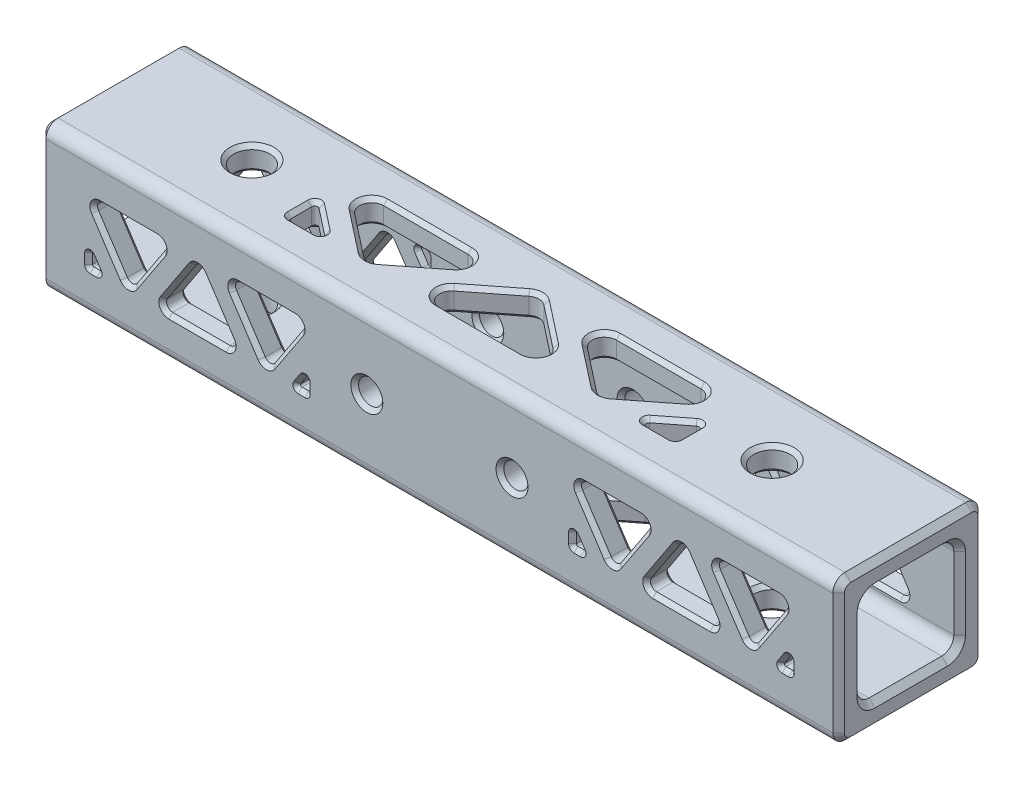
from build123d import *

# Parameters (mm, degrees)
SKETCH1_W                      = 19.05
SKETCH1_H                      = 19.05
SKETCH1_W_2                    = 12.7
SKETCH1_H_2                    = 12.7
BOSS_EXTRUDE1_DEPTH            = 52.3875
F_3_16_0_1875_DIAMETER_HOLE1_D = 4.7625
F_1_8_0_125_DIAMETER_HOLE1_D   = 3.175
CUT_EXTRUDE1_REACH             = 58.552
CUT_EXTRUDE2_REACH             = 58.552
CIRPATTERN1_COUNT              = 2
CIRPATTERN2_COUNT              = 2
FILLET1_R                      = 1.5875
FILLET4_R                      = 0.79375
FILLET2_R                      = 0.396875
FILLET3_R                      = 0.1984375
CHAMFER1_SIZE                  = 0.762
CHAMFER2_SIZE                  = 0.508


with BuildPart() as part:
    # Sketch1 → Boss-Extrude1 (new, symmetric)
    with BuildSketch(Plane(origin=(0, 0, 0), x_dir=(0, 0, -1), z_dir=(1, 0, 0))):
        Rectangle(SKETCH1_W, SKETCH1_H)
        Rectangle(SKETCH1_W_2, SKETCH1_H_2, mode=Mode.SUBTRACT)
    extrude(amount=BOSS_EXTRUDE1_DEPTH, both=True)

    # 3/16 (0.1875) Diameter Hole1 (through all)
    with Locations(Plane(origin=(0, 9.525, 0), x_dir=(1, 0, 0), z_dir=(0, 1, 0))):
        with Locations((-34.13125, 0), (34.13125, 0)):
            Hole(F_3_16_0_1875_DIAMETER_HOLE1_D / 2)

    # 1/8 (0.125) Diameter Hole1 (through all)
    with Locations(Plane(origin=(0, 0, -9.525), x_dir=(-1, 0, 0), z_dir=(0, 0, -1))):
        with Locations((-9.525, 0), (9.525, 0)):
            Hole(F_1_8_0_125_DIAMETER_HOLE1_D / 2)

    # Sketch8 → Cut-Extrude1 (cut, up to next)
    with BuildSketch(Plane(origin=(0, 9.525, 0), x_dir=(1, 0, 0), z_dir=(0, 1, 0)), mode=Mode.PRIVATE) as cut_extrude1_sk1:
        Polygon((-25.4, -0.065347152), (-25.4, -3.96875), (-20.420043773, -3.96875), align=None)
    cut_extrude1_tool1 = extrude(cut_extrude1_sk1.sketch, amount=-CUT_EXTRUDE1_REACH, mode=Mode.PRIVATE) & part.part
    # Sketch8 → Cut-Extrude1 (cut, up to next)
    with BuildSketch(Plane(origin=(0, 9.525, 0), x_dir=(1, 0, 0), z_dir=(0, 1, 0)), mode=Mode.PRIVATE) as cut_extrude1_sk2:
        Polygon((-25.4, 3.96875), (-15.273347924, -3.96875), (-5.146695849, 3.96875), align=None)
    cut_extrude1_tool2 = extrude(cut_extrude1_sk2.sketch, amount=-CUT_EXTRUDE1_REACH, mode=Mode.PRIVATE) & part.part
    # Sketch8 → Cut-Extrude1 (cut, up to next)
    with BuildSketch(Plane(origin=(0, 9.525, 0), x_dir=(1, 0, 0), z_dir=(0, 1, 0)), mode=Mode.PRIVATE) as cut_extrude1_sk3:
        Polygon((-10.126652076, -3.96875), (0, 3.96875), (10.126652076, -3.96875), align=None)
    cut_extrude1_tool3 = extrude(cut_extrude1_sk3.sketch, amount=-CUT_EXTRUDE1_REACH, mode=Mode.PRIVATE) & part.part
    # Sketch8 → Cut-Extrude1 (cut, up to next)
    with BuildSketch(Plane(origin=(0, 9.525, 0), x_dir=(1, 0, 0), z_dir=(0, 1, 0)), mode=Mode.PRIVATE) as cut_extrude1_sk4:
        Polygon((25.4, 3.96875), (15.273347924, -3.96875), (5.146695849, 3.96875), align=None)
    cut_extrude1_tool4 = extrude(cut_extrude1_sk4.sketch, amount=-CUT_EXTRUDE1_REACH, mode=Mode.PRIVATE) & part.part
    # Sketch8 → Cut-Extrude1 (cut, up to next)
    with BuildSketch(Plane(origin=(0, 9.525, 0), x_dir=(1, 0, 0), z_dir=(0, 1, 0)), mode=Mode.PRIVATE) as cut_extrude1_sk5:
        Polygon((25.4, -3.96875), (25.4, -0.065347152), (20.420043773, -3.96875), align=None)
    cut_extrude1_tool5 = extrude(cut_extrude1_sk5.sketch, amount=-CUT_EXTRUDE1_REACH, mode=Mode.PRIVATE) & part.part
    cut_extrude1_1 = cut_extrude1_tool1.solids().sort_by_distance((-23.740015, 9.525, 2.667616))[0]
    add(cut_extrude1_1, mode=Mode.SUBTRACT)
    cut_extrude1_2 = cut_extrude1_tool2.solids().sort_by_distance((-15.273348, 9.525, -1.322917))[0]
    add(cut_extrude1_2, mode=Mode.SUBTRACT)
    cut_extrude1_3 = cut_extrude1_tool3.solids().sort_by_distance((0, 9.525, 1.322917))[0]
    add(cut_extrude1_3, mode=Mode.SUBTRACT)
    cut_extrude1_4 = cut_extrude1_tool4.solids().sort_by_distance((15.273348, 9.525, -1.322917))[0]
    add(cut_extrude1_4, mode=Mode.SUBTRACT)
    cut_extrude1_5 = cut_extrude1_tool5.solids().sort_by_distance((23.740015, 9.525, 2.667616))[0]
    add(cut_extrude1_5, mode=Mode.SUBTRACT)
    cut_extrude1 = cut_extrude1_1 + cut_extrude1_2 + cut_extrude1_3 + cut_extrude1_4 + cut_extrude1_5  # Cut-Extrude1 as one shape, for the pattern or mirror that repeats it

    # Sketch9 → Cut-Extrude2 (cut, up to next)
    with BuildSketch(Plane.XY.offset(9.525), mode=Mode.PRIVATE) as cut_extrude2_sk1:
        Polygon((-46.0375, 3.96875), (-40.796126441, -3.96875), (-35.554752881, 3.96875), align=None)
    cut_extrude2_tool1 = extrude(cut_extrude2_sk1.sketch, amount=-CUT_EXTRUDE2_REACH, mode=Mode.PRIVATE) & part.part
    # Sketch9 → Cut-Extrude2 (cut, up to next)
    with BuildSketch(Plane.XY.offset(9.525), mode=Mode.PRIVATE) as cut_extrude2_sk2:
        Polygon((-36.991373559, -3.96875), (-31.75, 3.96875), (-26.508626441, -3.96875), align=None)
    cut_extrude2_tool2 = extrude(cut_extrude2_sk2.sketch, amount=-CUT_EXTRUDE2_REACH, mode=Mode.PRIVATE) & part.part
    # Sketch9 → Cut-Extrude2 (cut, up to next)
    with BuildSketch(Plane.XY.offset(9.525), mode=Mode.PRIVATE) as cut_extrude2_sk3:
        Polygon((-17.4625, 3.96875), (-22.703873559, -3.96875), (-27.945247119, 3.96875), align=None)
    cut_extrude2_tool3 = extrude(cut_extrude2_sk3.sketch, amount=-CUT_EXTRUDE2_REACH, mode=Mode.PRIVATE) & part.part
    # Sketch9 → Cut-Extrude2 (cut, up to next)
    with BuildSketch(Plane.XY.offset(9.525), mode=Mode.PRIVATE) as cut_extrude2_sk4:
        Polygon((-46.0375, -1.793141545), (-46.0375, -3.96875), (-44.600879322, -3.96875), align=None)
    cut_extrude2_tool4 = extrude(cut_extrude2_sk4.sketch, amount=-CUT_EXTRUDE2_REACH, mode=Mode.PRIVATE) & part.part
    # Sketch9 → Cut-Extrude2 (cut, up to next)
    with BuildSketch(Plane.XY.offset(9.525), mode=Mode.PRIVATE) as cut_extrude2_sk5:
        Polygon((-17.4625, -3.96875), (-17.4625, -1.793141545), (-18.899120678, -3.96875), align=None)
    cut_extrude2_tool5 = extrude(cut_extrude2_sk5.sketch, amount=-CUT_EXTRUDE2_REACH, mode=Mode.PRIVATE) & part.part
    # Sketch9 → Cut-Extrude2 (cut, up to next)
    with BuildSketch(Plane.XY.offset(9.525), mode=Mode.PRIVATE) as cut_extrude2_sk6:
        Polygon((17.4625, 3.96875), (22.703873559, -3.96875), (27.945247119, 3.96875), align=None)
    cut_extrude2_tool6 = extrude(cut_extrude2_sk6.sketch, amount=-CUT_EXTRUDE2_REACH, mode=Mode.PRIVATE) & part.part
    # Sketch9 → Cut-Extrude2 (cut, up to next)
    with BuildSketch(Plane.XY.offset(9.525), mode=Mode.PRIVATE) as cut_extrude2_sk7:
        Polygon((26.508626441, -3.96875), (31.75, 3.96875), (36.991373559, -3.96875), align=None)
    cut_extrude2_tool7 = extrude(cut_extrude2_sk7.sketch, amount=-CUT_EXTRUDE2_REACH, mode=Mode.PRIVATE) & part.part
    # Sketch9 → Cut-Extrude2 (cut, up to next)
    with BuildSketch(Plane.XY.offset(9.525), mode=Mode.PRIVATE) as cut_extrude2_sk8:
        Polygon((46.0375, 3.96875), (40.796126441, -3.96875), (35.554752881, 3.96875), align=None)
    cut_extrude2_tool8 = extrude(cut_extrude2_sk8.sketch, amount=-CUT_EXTRUDE2_REACH, mode=Mode.PRIVATE) & part.part
    # Sketch9 → Cut-Extrude2 (cut, up to next)
    with BuildSketch(Plane.XY.offset(9.525), mode=Mode.PRIVATE) as cut_extrude2_sk9:
        Polygon((17.4625, -1.793141545), (17.4625, -3.96875), (18.899120678, -3.96875), align=None)
    cut_extrude2_tool9 = extrude(cut_extrude2_sk9.sketch, amount=-CUT_EXTRUDE2_REACH, mode=Mode.PRIVATE) & part.part
    # Sketch9 → Cut-Extrude2 (cut, up to next)
    with BuildSketch(Plane.XY.offset(9.525), mode=Mode.PRIVATE) as cut_extrude2_sk10:
        Polygon((46.0375, -1.793141545), (46.0375, -3.96875), (44.600879322, -3.96875), align=None)
    cut_extrude2_tool10 = extrude(cut_extrude2_sk10.sketch, amount=-CUT_EXTRUDE2_REACH, mode=Mode.PRIVATE) & part.part
    cut_extrude2_1 = cut_extrude2_tool1.solids().sort_by_distance((-40.796126, 1.322917, 9.525))[0]
    add(cut_extrude2_1, mode=Mode.SUBTRACT)
    cut_extrude2_2 = cut_extrude2_tool2.solids().sort_by_distance((-31.75, -1.322917, 9.525))[0]
    add(cut_extrude2_2, mode=Mode.SUBTRACT)
    cut_extrude2_3 = cut_extrude2_tool3.solids().sort_by_distance((-22.703874, 1.322917, 9.525))[0]
    add(cut_extrude2_3, mode=Mode.SUBTRACT)
    cut_extrude2_4 = cut_extrude2_tool4.solids().sort_by_distance((-45.558626, -3.243547, 9.525))[0]
    add(cut_extrude2_4, mode=Mode.SUBTRACT)
    cut_extrude2_5 = cut_extrude2_tool5.solids().sort_by_distance((-17.941374, -3.243547, 9.525))[0]
    add(cut_extrude2_5, mode=Mode.SUBTRACT)
    cut_extrude2_6 = cut_extrude2_tool6.solids().sort_by_distance((22.703874, 1.322917, 9.525))[0]
    add(cut_extrude2_6, mode=Mode.SUBTRACT)
    cut_extrude2_7 = cut_extrude2_tool7.solids().sort_by_distance((31.75, -1.322917, 9.525))[0]
    add(cut_extrude2_7, mode=Mode.SUBTRACT)
    cut_extrude2_8 = cut_extrude2_tool8.solids().sort_by_distance((40.796126, 1.322917, 9.525))[0]
    add(cut_extrude2_8, mode=Mode.SUBTRACT)
    cut_extrude2_9 = cut_extrude2_tool9.solids().sort_by_distance((17.941374, -3.243547, 9.525))[0]
    add(cut_extrude2_9, mode=Mode.SUBTRACT)
    cut_extrude2_10 = cut_extrude2_tool10.solids().sort_by_distance((45.558626, -3.243547, 9.525))[0]
    add(cut_extrude2_10, mode=Mode.SUBTRACT)
    cut_extrude2 = cut_extrude2_1 + cut_extrude2_2 + cut_extrude2_3 + cut_extrude2_4 + cut_extrude2_5 + cut_extrude2_6 + cut_extrude2_7 + cut_extrude2_8 + cut_extrude2_9 + cut_extrude2_10  # Cut-Extrude2 as one shape, for the pattern or mirror that repeats it

    # CirPattern1: Cut-Extrude1 ×2 about axis
    cirpattern1_axis = Axis((57.62625, 0, 0), (-1, 0, 0))
    for i in range(1, CIRPATTERN1_COUNT):
        add(cut_extrude1.rotate(cirpattern1_axis, i * 360 / CIRPATTERN1_COUNT), mode=Mode.SUBTRACT)

    # CirPattern2: Cut-Extrude2 ×2 about axis
    cirpattern2_axis = Axis((57.62625, 0, 0), (-1, 0, 0))
    for i in range(1, CIRPATTERN2_COUNT):
        add(cut_extrude2.rotate(cirpattern2_axis, i * 360 / CIRPATTERN2_COUNT), mode=Mode.SUBTRACT)

    # Fillet1
    fillet1_edges = [part.edges().sort_by_distance(p)[0] for p in [
        (0, -6.35, -6.35),
        (0, 6.35, -6.35),
        (0, 6.35, 6.35),
        (0, -6.35, 6.35),
        (5.146695849, -7.9375, 3.96875),
        (25.4, -7.9375, 3.96875),
        (15.273347924, -7.9375, -3.96875),
        (10.126652076, -7.9375, -3.96875),
        (0, -7.9375, 3.96875),
        (-10.126652076, -7.9375, -3.96875),
        (-25.4, -7.9375, 3.96875),
        (-5.146695849, -7.9375, 3.96875),
        (-15.273347924, -7.9375, -3.96875),
        (0, -9.525, -9.525),
        (0, -9.525, 9.525),
        (0, 9.525, 9.525),
        (0, 9.525, -9.525),
        (5.146695849, 7.9375, -3.96875),
        (25.4, 7.9375, -3.96875),
        (15.273347924, 7.9375, 3.96875),
        (0, 7.9375, -3.96875),
        (10.126652076, 7.9375, 3.96875),
        (-10.126652076, 7.9375, 3.96875),
        (-25.4, 7.9375, -3.96875),
        (-5.146695849, 7.9375, -3.96875),
        (-15.273347924, 7.9375, 3.96875),
    ]]
    fillet(fillet1_edges, radius=FILLET1_R)

    # Fillet4
    fillet4_edges = [part.edges().sort_by_distance(p)[0] for p in [
        (-22.703873559, -3.96875, 7.9375),
        (-17.4625, 3.96875, 7.9375),
        (-27.945247119, 3.96875, 7.9375),
        (-40.796126441, -3.96875, 7.9375),
        (-35.554752881, 3.96875, 7.9375),
        (-46.0375, 3.96875, 7.9375),
        (22.703873559, -3.96875, 7.9375),
        (27.945247119, 3.96875, 7.9375),
        (17.4625, 3.96875, 7.9375),
        (40.796126441, -3.96875, 7.9375),
        (46.0375, 3.96875, 7.9375),
        (35.554752881, 3.96875, 7.9375),
        (26.508626441, -3.96875, 7.9375),
        (36.991373559, -3.96875, 7.9375),
        (31.75, 3.96875, 7.9375),
        (-36.991373559, -3.96875, 7.9375),
        (-26.508626441, -3.96875, 7.9375),
        (-31.75, 3.96875, 7.9375),
        (-27.945247119, -3.96875, -7.9375),
        (-17.4625, -3.96875, -7.9375),
        (-22.703873559, 3.96875, -7.9375),
        (-46.0375, -3.96875, -7.9375),
        (-35.554752881, -3.96875, -7.9375),
        (-40.796126441, 3.96875, -7.9375),
        (17.4625, -3.96875, -7.9375),
        (27.945247119, -3.96875, -7.9375),
        (22.703873559, 3.96875, -7.9375),
        (35.554752881, -3.96875, -7.9375),
        (46.0375, -3.96875, -7.9375),
        (40.796126441, 3.96875, -7.9375),
        (36.991373559, 3.96875, -7.9375),
        (31.75, -3.96875, -7.9375),
        (26.508626441, 3.96875, -7.9375),
        (-26.508626441, 3.96875, -7.9375),
        (-31.75, -3.96875, -7.9375),
        (-36.991373559, 3.96875, -7.9375),
    ]]
    fillet(fillet4_edges, radius=FILLET4_R)

    # Fillet2
    fillet2_edges = [part.edges().sort_by_distance(p)[0] for p in [
        (25.4, -7.9375, -3.96875),
        (20.420043773, -7.9375, -3.96875),
        (25.4, -7.9375, -0.065347152),
        (-20.420043773, -7.9375, -3.96875),
        (-25.4, -7.9375, -3.96875),
        (-25.4, -7.9375, -0.065347152),
        (25.4, 7.9375, 3.96875),
        (20.420043773, 7.9375, 3.96875),
        (25.4, 7.9375, 0.065347152),
        (-20.420043773, 7.9375, 3.96875),
        (-25.4, 7.9375, 3.96875),
        (-25.4, 7.9375, 0.065347152),
    ]]
    fillet(fillet2_edges, radius=FILLET2_R)

    # Fillet3
    fillet3_edges = [part.edges().sort_by_distance(p)[0] for p in [
        (-17.4625, -1.793141545, 7.9375),
        (-18.899120678, -3.96875, 7.9375),
        (-17.4625, -3.96875, 7.9375),
        (-46.0375, -1.793141545, 7.9375),
        (-46.0375, -3.96875, 7.9375),
        (-44.600879322, -3.96875, 7.9375),
        (17.4625, -1.793141545, 7.9375),
        (17.4625, -3.96875, 7.9375),
        (18.899120678, -3.96875, 7.9375),
        (46.0375, -1.793141545, 7.9375),
        (44.600879322, -3.96875, 7.9375),
        (46.0375, -3.96875, 7.9375),
        (-17.4625, 3.96875, -7.9375),
        (-17.4625, 1.793141545, -7.9375),
        (-18.899120678, 3.96875, -7.9375),
        (-44.600879322, 3.96875, -7.9375),
        (-46.0375, 3.96875, -7.9375),
        (-46.0375, 1.793141545, -7.9375),
        (18.899120678, 3.96875, -7.9375),
        (17.4625, 3.96875, -7.9375),
        (17.4625, 1.793141545, -7.9375),
        (46.0375, 3.96875, -7.9375),
        (46.0375, 1.793141545, -7.9375),
        (44.600879322, 3.96875, -7.9375),
    ]]
    fillet(fillet3_edges, radius=FILLET3_R)

    # Chamfer1
    chamfer1_edges = [part.edges().sort_by_distance(p)[0] for p in [
        (-52.3875, -6.35, 0),
        (52.3875, -6.35, 0),
        (-52.3875, 0, -6.35),
        (52.3875, 0, -6.35),
        (-52.3875, 6.35, 0),
        (52.3875, 6.35, 0),
        (-52.3875, 0, 6.35),
        (52.3875, 0, 6.35),
        (-52.3875, 0, -9.525),
        (52.3875, 0, -9.525),
        (-52.3875, -9.525, 0),
        (-52.3875, 0, 9.525),
        (-52.3875, 9.525, 0),
        (-52.3875, 9.060032015, 9.060032015),
        (-52.3875, -9.060032015, 9.060032015),
        (-52.3875, 9.060032015, -9.060032015),
        (-52.3875, -9.060032015, -9.060032015),
        (52.3875, -9.525, 0),
        (52.3875, 9.525, 0),
        (52.3875, 0, 9.525),
        (52.3875, 9.060032015, 9.060032015),
        (52.3875, -9.060032015, 9.060032015),
        (52.3875, 9.060032015, -9.060032015),
        (52.3875, -9.060032015, -9.060032015),
        (-52.3875, -5.885032015, -5.885032015),
        (52.3875, -5.885032015, -5.885032015),
        (-52.3875, 5.885032015, -5.885032015),
        (52.3875, 5.885032015, -5.885032015),
        (-52.3875, 5.885032015, 5.885032015),
        (52.3875, 5.885032015, 5.885032015),
        (-52.3875, -5.885032015, 5.885032015),
        (52.3875, -5.885032015, 5.885032015),
    ]]
    chamfer(chamfer1_edges, length=CHAMFER1_SIZE)

    # Chamfer2
    chamfer2_edges = [part.edges().sort_by_distance(p)[0] for p in [
        (36.5125, 6.35, 0),
        (36.5125, -6.35, 0),
        (36.5125, -9.525, 0),
        (36.5125, 9.525, 0),
        (15.273347924, -9.525, 3.96875),
        (15.273347924, -6.35, 3.96875),
        (19.01666457, -9.525, -1.034653356),
        (19.01666457, -6.35, -1.034653356),
        (11.530031279, -9.525, -1.034653356),
        (11.530031279, -6.35, -1.034653356),
        (-3.743316645, -9.525, 1.034653356),
        (-3.743316645, -6.35, 1.034653356),
        (3.743316645, -9.525, 1.034653356),
        (3.743316645, -6.35, 1.034653356),
        (0, -9.525, -3.96875),
        (0, -6.35, -3.96875),
        (-15.273347924, -9.525, 3.96875),
        (-15.273347924, -6.35, 3.96875),
        (-31.75, 6.35, 0),
        (-31.75, -6.35, 0),
        (-11.530031279, -9.525, -1.034653356),
        (-11.530031279, -6.35, -1.034653356),
        (-31.75, -9.525, 0),
        (-31.75, 9.525, 0),
        (-19.01666457, -9.525, -1.034653356),
        (-19.01666457, -6.35, -1.034653356),
        (15.273347924, 9.525, -3.96875),
        (15.273347924, 6.35, -3.96875),
        (19.01666457, 9.525, 1.034653356),
        (19.01666457, 6.35, 1.034653356),
        (11.530031279, 9.525, 1.034653356),
        (11.530031279, 6.35, 1.034653356),
        (3.743316645, 9.525, -1.034653356),
        (3.743316645, 6.35, -1.034653356),
        (0, 9.525, 3.96875),
        (0, 6.35, 3.96875),
        (-3.743316645, 9.525, -1.034653356),
        (-3.743316645, 6.35, -1.034653356),
        (-15.273347924, 9.525, -3.96875),
        (-15.273347924, 6.35, -3.96875),
        (-11.530031279, 9.525, 1.034653356),
        (-11.530031279, 6.35, 1.034653356),
        (-19.01666457, 9.525, 1.034653356),
        (-19.01666457, 6.35, 1.034653356),
        (22.301925311, -9.525, 2.899270205),
        (22.301925311, -6.35, 2.899270205),
        (8.244770538, -9.525, 2.899270205),
        (8.244770538, -6.35, 2.899270205),
        (15.273347924, -9.525, -3.539201424),
        (15.273347924, -6.35, -3.539201424),
        (0, -9.525, 3.539201424),
        (0, -6.35, 3.539201424),
        (7.028577387, -9.525, -2.899270205),
        (7.028577387, -6.35, -2.899270205),
        (-7.028577387, -9.525, -2.899270205),
        (-7.028577387, -6.35, -2.899270205),
        (-8.244770538, -9.525, 2.899270205),
        (-8.244770538, -6.35, 2.899270205),
        (-22.301925311, -9.525, 2.899270205),
        (-22.301925311, -6.35, 2.899270205),
        (-15.273347924, -9.525, -3.539201424),
        (-15.273347924, -6.35, -3.539201424),
        (22.301925311, 9.525, -2.899270205),
        (22.301925311, 6.35, -2.899270205),
        (8.244770538, 9.525, -2.899270205),
        (8.244770538, 6.35, -2.899270205),
        (15.273347924, 9.525, 3.539201424),
        (15.273347924, 6.35, 3.539201424),
        (7.028577387, 9.525, 2.899270205),
        (7.028577387, 6.35, 2.899270205),
        (0, 9.525, -3.539201424),
        (0, 6.35, -3.539201424),
        (-7.028577387, 9.525, 2.899270205),
        (-7.028577387, 6.35, 2.899270205),
        (-8.244770538, 9.525, -2.899270205),
        (-8.244770538, 6.35, -2.899270205),
        (-22.301925311, 9.525, -2.899270205),
        (-22.301925311, 6.35, -2.899270205),
        (-15.273347924, 9.525, 3.539201424),
        (-15.273347924, 6.35, 3.539201424),
        (7.9375, 0, 6.35),
        (7.9375, 0, -6.35),
        (7.9375, 0, -9.525),
        (7.9375, 0, 9.525),
        (-38.250731901, 0.11402205, -9.525),
        (-38.250731901, 0.11402205, -6.35),
        (-43.34152098, 0.11402205, -9.525),
        (-43.34152098, 0.11402205, -6.35),
        (-40.796126441, -3.96875, -9.525),
        (-40.796126441, -3.96875, -6.35),
        (-31.75, 3.96875, -9.525),
        (-31.75, 3.96875, -6.35),
        (-34.295394539, -0.11402205, -9.525),
        (-34.295394539, -0.11402205, -6.35),
        (-29.204605461, -0.11402205, -9.525),
        (-29.204605461, -0.11402205, -6.35),
        (-25.249268099, 0.11402205, -9.525),
        (-25.249268099, 0.11402205, -6.35),
        (-22.703873559, -3.96875, -9.525),
        (-22.703873559, -3.96875, -6.35),
        (-20.15847902, 0.11402205, -9.525),
        (-20.15847902, 0.11402205, -6.35),
        (20.15847902, 0.11402205, -9.525),
        (20.15847902, 0.11402205, -6.35),
        (22.703873559, -3.96875, -9.525),
        (22.703873559, -3.96875, -6.35),
        (25.249268099, 0.11402205, -9.525),
        (25.249268099, 0.11402205, -6.35),
        (31.75, 3.96875, -9.525),
        (-11.1125, 0, -6.35),
        (31.75, 3.96875, -6.35),
        (-11.1125, 0, 6.35),
        (29.204605461, -0.11402205, -9.525),
        (-11.1125, 0, 9.525),
        (29.204605461, -0.11402205, -6.35),
        (-11.1125, 0, -9.525),
        (34.295394539, -0.11402205, -9.525),
        (34.295394539, -0.11402205, -6.35),
        (38.250731901, 0.11402205, -9.525),
        (38.250731901, 0.11402205, -6.35),
        (40.796126441, -3.96875, -9.525),
        (40.796126441, -3.96875, -6.35),
        (43.34152098, 0.11402205, -9.525),
        (43.34152098, 0.11402205, -6.35),
        (40.796126441, 3.96875, 9.525),
        (40.796126441, 3.96875, 6.35),
        (43.34152098, -0.11402205, 9.525),
        (43.34152098, -0.11402205, 6.35),
        (38.250731901, -0.11402205, 9.525),
        (38.250731901, -0.11402205, 6.35),
        (29.204605461, 0.11402205, 9.525),
        (29.204605461, 0.11402205, 6.35),
        (34.295394539, 0.11402205, 9.525),
        (34.295394539, 0.11402205, 6.35),
        (31.75, -3.96875, 9.525),
        (31.75, -3.96875, 6.35),
        (20.15847902, -0.11402205, 9.525),
        (20.15847902, -0.11402205, 6.35),
        (22.703873559, 3.96875, 9.525),
        (22.703873559, 3.96875, 6.35),
        (25.249268099, -0.11402205, 9.525),
        (25.249268099, -0.11402205, 6.35),
        (-22.703873559, 3.96875, 9.525),
        (-22.703873559, 3.96875, 6.35),
        (-20.15847902, -0.11402205, 9.525),
        (-20.15847902, -0.11402205, 6.35),
        (-25.249268099, -0.11402205, 9.525),
        (-25.249268099, -0.11402205, 6.35),
        (-29.204605461, 0.11402205, 9.525),
        (-29.204605461, 0.11402205, 6.35),
        (-31.75, -3.96875, 9.525),
        (-31.75, -3.96875, 6.35),
        (-34.295394539, 0.11402205, 9.525),
        (-34.295394539, 0.11402205, 6.35),
        (-40.796126441, 3.96875, 9.525),
        (-40.796126441, 3.96875, 6.35),
        (-38.250731901, -0.11402205, 9.525),
        (-38.250731901, -0.11402205, 6.35),
        (-43.34152098, -0.11402205, 9.525),
        (-43.34152098, -0.11402205, 6.35),
        (-40.796126441, 3.322027114, -9.525),
        (-40.796126441, 3.322027114, -6.35),
        (-45.261178075, -3.551075734, -9.525),
        (-45.261178075, -3.551075734, -6.35),
        (-36.331074806, -3.551075734, -9.525),
        (-36.331074806, -3.551075734, -6.35),
        (-36.215051635, 3.551075734, -9.525),
        (-36.215051635, 3.551075734, -6.35),
        (-27.284948365, 3.551075734, -9.525),
        (-27.284948365, 3.551075734, -6.35),
        (-31.75, -3.322027114, -9.525),
        (-31.75, -3.322027114, -6.35),
        (-27.168925194, -3.551075734, -9.525),
        (-27.168925194, -3.551075734, -6.35),
        (-18.238821925, -3.551075734, -9.525),
        (-18.238821925, -3.551075734, -6.35),
        (-22.703873559, 3.322027114, -9.525),
        (-22.703873559, 3.322027114, -6.35),
        (18.238821925, -3.551075734, -9.525),
        (18.238821925, -3.551075734, -6.35),
        (27.168925194, -3.551075734, -9.525),
        (27.168925194, -3.551075734, -6.35),
        (22.703873559, 3.322027114, -9.525),
        (22.703873559, 3.322027114, -6.35),
        (27.284948365, 3.551075734, -9.525),
        (27.284948365, 3.551075734, -6.35),
        (36.215051635, 3.551075734, -9.525),
        (36.215051635, 3.551075734, -6.35),
        (31.75, -3.322027114, -9.525),
        (31.75, -3.322027114, -6.35),
        (36.331074806, -3.551075734, -9.525),
        (36.331074806, -3.551075734, -6.35),
        (40.796126441, 3.322027114, -9.525),
        (40.796126441, 3.322027114, -6.35),
        (45.261178075, -3.551075734, -9.525),
        (45.261178075, -3.551075734, -6.35),
        (45.261178075, 3.551075734, 9.525),
        (45.261178075, 3.551075734, 6.35),
        (40.796126441, -3.322027114, 9.525),
        (40.796126441, -3.322027114, 6.35),
        (36.331074806, 3.551075734, 9.525),
        (36.331074806, 3.551075734, 6.35),
        (31.75, 3.322027114, 9.525),
        (31.75, 3.322027114, 6.35),
        (36.215051635, -3.551075734, 9.525),
        (36.215051635, -3.551075734, 6.35),
        (27.284948365, -3.551075734, 9.525),
        (27.284948365, -3.551075734, 6.35),
        (18.238821925, 3.551075734, 9.525),
        (18.238821925, 3.551075734, 6.35),
        (27.168925194, 3.551075734, 9.525),
        (27.168925194, 3.551075734, 6.35),
        (22.703873559, -3.322027114, 9.525),
        (22.703873559, -3.322027114, 6.35),
        (-18.238821925, 3.551075734, 9.525),
        (-18.238821925, 3.551075734, 6.35),
        (-22.703873559, -3.322027114, 9.525),
        (-22.703873559, -3.322027114, 6.35),
        (-27.168925194, 3.551075734, 9.525),
        (-27.168925194, 3.551075734, 6.35),
        (-27.284948365, -3.551075734, 9.525),
        (-27.284948365, -3.551075734, 6.35),
        (-36.215051635, -3.551075734, 9.525),
        (-36.215051635, -3.551075734, 6.35),
        (-31.75, 3.322027114, 9.525),
        (-31.75, 3.322027114, 6.35),
        (-36.331074806, 3.551075734, 9.525),
        (-36.331074806, 3.551075734, 6.35),
        (-40.796126441, -3.322027114, 9.525),
        (-40.796126441, -3.322027114, 6.35),
        (-45.261178075, 3.551075734, 9.525),
        (-45.261178075, 3.551075734, 6.35),
        (23.286419179, 9.525, 3.96875),
        (23.286419179, 6.35, 3.96875),
        (23.041586735, 9.525, 1.913925059),
        (23.041586735, 6.35, 1.913925059),
        (25.4, 9.525, 2.22628197),
        (25.4, 6.35, 2.22628197),
        (-25.4, 9.525, 2.22628197),
        (-25.4, 6.35, 2.22628197),
        (-23.041586735, 9.525, 1.913925059),
        (-23.041586735, 6.35, 1.913925059),
        (-23.286419179, 9.525, 3.96875),
        (-23.286419179, 6.35, 3.96875),
        (-25.4, -9.525, -2.22628197),
        (-25.4, -6.35, -2.22628197),
        (-23.041586735, -9.525, -1.913925059),
        (-23.041586735, -6.35, -1.913925059),
        (-23.286419179, -9.525, -3.96875),
        (-23.286419179, -6.35, -3.96875),
        (23.286419179, -9.525, -3.96875),
        (23.286419179, -6.35, -3.96875),
        (23.041586735, -9.525, -1.913925059),
        (23.041586735, -6.35, -1.913925059),
        (25.4, -9.525, -2.22628197),
        (25.4, -6.35, -2.22628197),
        (21.194562446, 9.525, 3.701380051),
        (21.194562446, 6.35, 3.701380051),
        (25.176822854, 9.525, 0.523843285),
        (25.176822854, 6.35, 0.523843285),
        (25.283758004, 9.525, 3.852508004),
        (25.283758004, 6.35, 3.852508004),
        (-25.176822854, 9.525, 0.523843285),
        (-25.176822854, 6.35, 0.523843285),
        (-21.194562446, 9.525, 3.701380051),
        (-21.194562446, 6.35, 3.701380051),
        (-25.283758004, 9.525, 3.852508004),
        (-25.283758004, 6.35, 3.852508004),
        (-25.176822854, -9.525, -0.523843285),
        (-25.176822854, -6.35, -0.523843285),
        (-21.194562446, -9.525, -3.701380051),
        (-21.194562446, -6.35, -3.701380051),
        (-25.283758004, -9.525, -3.852508004),
        (-25.283758004, -6.35, -3.852508004),
        (21.194562446, -9.525, -3.701380051),
        (21.194562446, -6.35, -3.701380051),
        (25.176822854, -9.525, -0.523843285),
        (25.176822854, -6.35, -0.523843285),
        (25.283758004, -9.525, -3.852508004),
        (25.283758004, -6.35, -3.852508004),
        (-45.404386608, 3.96875, -9.525),
        (-45.404386608, 3.96875, -6.35),
        (-46.0375, 3.112042324, -9.525),
        (-46.0375, 3.112042324, -6.35),
        (-45.238793971, 3.002696451, -9.525),
        (-45.238793971, 3.002696451, -6.35),
        (-18.095613392, 3.96875, -9.525),
        (-18.095613392, 3.96875, -6.35),
        (-18.261206029, 3.002696451, -9.525),
        (-18.261206029, 3.002696451, -6.35),
        (-17.4625, 3.112042324, -9.525),
        (-17.4625, 3.112042324, -6.35),
        (18.095613392, 3.96875, -9.525),
        (18.095613392, 3.96875, -6.35),
        (17.4625, 3.112042324, -9.525),
        (17.4625, 3.112042324, -6.35),
        (18.261206029, 3.002696451, -9.525),
        (18.261206029, 3.002696451, -6.35),
        (45.404386608, 3.96875, -9.525),
        (45.404386608, 3.96875, -6.35),
        (45.238793971, 3.002696451, -9.525),
        (45.238793971, 3.002696451, -6.35),
        (46.0375, 3.112042324, -9.525),
        (46.0375, 3.112042324, -6.35),
        (46.0375, -3.112042324, 9.525),
        (46.0375, -3.112042324, 6.35),
        (45.404386608, -3.96875, 9.525),
        (45.404386608, -3.96875, 6.35),
        (45.238793971, -3.002696451, 9.525),
        (45.238793971, -3.002696451, 6.35),
        (18.261206029, -3.002696451, 9.525),
        (18.261206029, -3.002696451, 6.35),
        (18.095613392, -3.96875, 9.525),
        (18.095613392, -3.96875, 6.35),
        (17.4625, -3.112042324, 9.525),
        (17.4625, -3.112042324, 6.35),
        (-18.095613392, -3.96875, 9.525),
        (-18.095613392, -3.96875, 6.35),
        (-18.261206029, -3.002696451, 9.525),
        (-18.261206029, -3.002696451, 6.35),
        (-17.4625, -3.112042324, 9.525),
        (-17.4625, -3.112042324, 6.35),
        (-45.238793971, -3.002696451, 9.525),
        (-45.238793971, -3.002696451, 6.35),
        (-45.404386608, -3.96875, 9.525),
        (-45.404386608, -3.96875, 6.35),
        (-46.0375, -3.112042324, 9.525),
        (-46.0375, -3.112042324, 6.35),
        (-45.979379002, 3.910629002, -9.525),
        (-45.979379002, 3.910629002, -6.35),
        (-45.89614863, 2.263723168, -9.525),
        (-45.89614863, 2.263723168, -6.35),
        (-44.794959803, 3.864331433, -9.525),
        (-44.794959803, 3.864331433, -6.35),
        (-18.705040197, 3.864331433, -9.525),
        (-18.705040197, 3.864331433, -6.35),
        (-17.60385137, 2.263723168, -9.525),
        (-17.60385137, 2.263723168, -6.35),
        (-17.520620998, 3.910629002, -9.525),
        (-17.520620998, 3.910629002, -6.35),
        (17.520620998, 3.910629002, -9.525),
        (17.520620998, 3.910629002, -6.35),
        (17.60385137, 2.263723168, -9.525),
        (17.60385137, 2.263723168, -6.35),
        (18.705040197, 3.864331433, -9.525),
        (18.705040197, 3.864331433, -6.35),
        (44.794959803, 3.864331433, -9.525),
        (44.794959803, 3.864331433, -6.35),
        (45.979379002, 3.910629002, -9.525),
        (45.979379002, 3.910629002, -6.35),
        (45.89614863, 2.263723168, -9.525),
        (45.89614863, 2.263723168, -6.35),
        (45.979379002, -3.910629002, 9.525),
        (45.979379002, -3.910629002, 6.35),
        (45.89614863, -2.263723168, 9.525),
        (45.89614863, -2.263723168, 6.35),
        (44.794959803, -3.864331433, 9.525),
        (44.794959803, -3.864331433, 6.35),
        (18.705040197, -3.864331433, 9.525),
        (18.705040197, -3.864331433, 6.35),
        (17.60385137, -2.263723168, 9.525),
        (17.60385137, -2.263723168, 6.35),
        (17.520620998, -3.910629002, 9.525),
        (17.520620998, -3.910629002, 6.35),
        (-18.705040197, -3.864331433, 9.525),
        (-18.705040197, -3.864331433, 6.35),
        (-17.60385137, -2.263723168, 9.525),
        (-17.60385137, -2.263723168, 6.35),
        (-17.520620998, -3.910629002, 9.525),
        (-17.520620998, -3.910629002, 6.35),
        (-44.794959803, -3.864331433, 9.525),
        (-44.794959803, -3.864331433, 6.35),
        (-45.89614863, -2.263723168, 9.525),
        (-45.89614863, -2.263723168, 6.35),
        (-45.979379002, -3.910629002, 9.525),
        (-45.979379002, -3.910629002, 6.35),
    ]]
    chamfer(chamfer2_edges, length=CHAMFER2_SIZE)


solid = part.part
